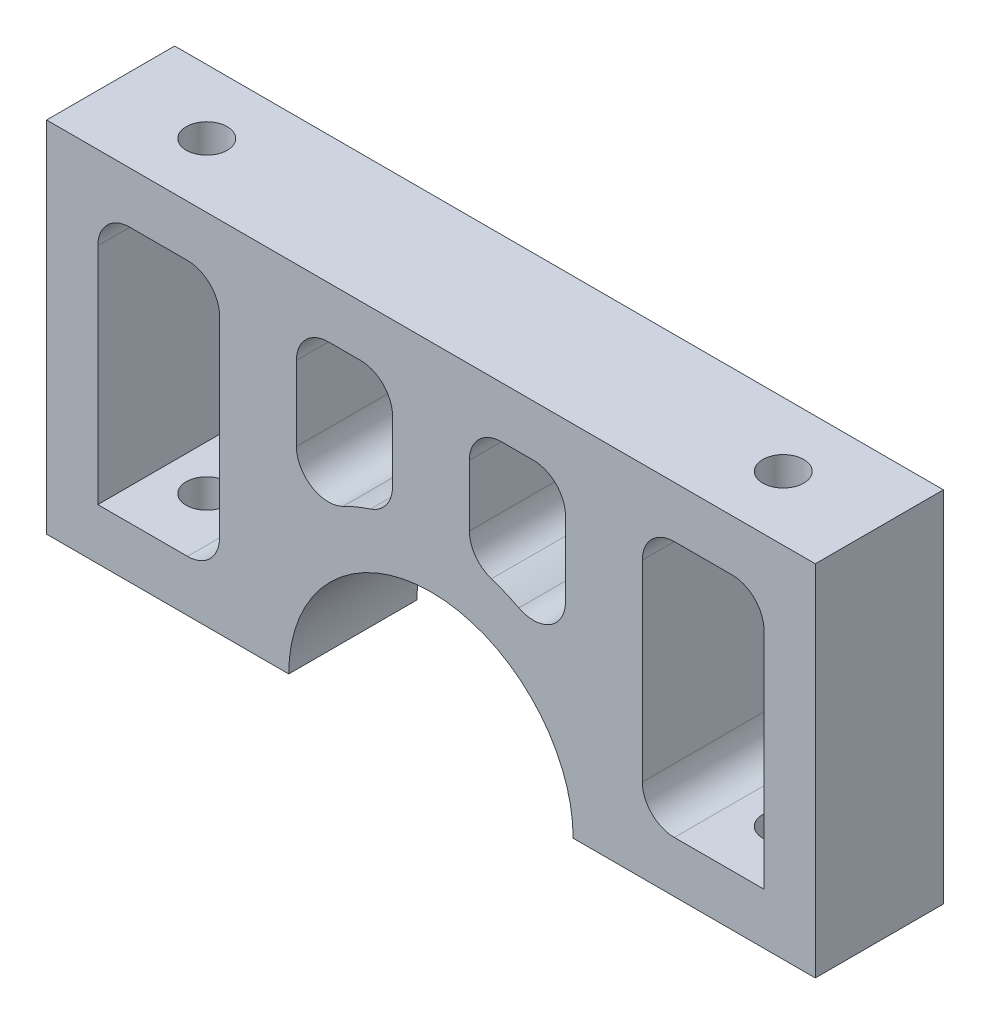
from build123d import *

# Parameters (mm, degrees)
EXTRUDE_1_DEPTH     = 10
SKETCH_2_W          = 9.5
SKETCH_2_H          = 20
CUT_EXTRUDE_2_DEPTH = 15
FILLET_1_R          = 2.5
SKETCH_3_R          = 1.6
CUT_EXTRUDE_1_DEPTH = 43.237424164


with BuildPart() as part:
    # ｽｹｯﾁ1 → ﾎﾞｽ - 押し出し1 (new body)
    with BuildSketch(Plane.XY):
        with BuildLine():
            Line((11.1, 0), (30, 0))
            Line((30, 0), (30, 28))
            Line((30, 28), (-30, 28))
            Line((-30, 28), (-30, 0))
            Line((-30, 0), (-11.1, 0))
            ThreePointArc((-11.1, 0), (0, 11.1), (11.1, 0))
        make_face()
    extrude(amount=EXTRUDE_1_DEPTH)

    # ｽｹｯﾁ2 → ｶｯﾄ - 押し出し2 (cut)
    with BuildSketch(Plane.XY.offset(10)):
        with BuildLine():
            Line((10.5, 24), (3, 24))
            Line((3, 24), (3, 14.798986452))
            ThreePointArc((3, 14.798986452), (7.032617747, 13.362345888), (10.5, 10.851727973))
            Line((10.5, 10.851727973), (10.5, 24))
        make_face()
        with BuildLine():
            Line((-3, 14.798986452), (-3, 24))
            Line((-3, 24), (-10.5, 24))
            Line((-10.5, 24), (-10.5, 10.851727973))
            ThreePointArc((-10.5, 10.851727973), (-7.032617747, 13.362345888), (-3, 14.798986452))
        make_face()
        with Locations((21.25, 14)):
            Rectangle(SKETCH_2_W, SKETCH_2_H)
        with Locations((-21.25, 14)):
            Rectangle(SKETCH_2_W, SKETCH_2_H)
    extrude(amount=-CUT_EXTRUDE_2_DEPTH, mode=Mode.SUBTRACT)

    # ﾌｨﾚｯﾄ1
    fillet_1_edges = [part.edges().sort_by_distance(p)[0] for p in [
        (-16.5, 4, 5),
        (-3, 14.798986452, 5),
        (10.5, 10.851727973, 5),
        (16.5, 4, 5),
        (3, 14.798986452, 5),
        (-10.5, 10.851727973, 5),
        (16.5, 24, 5),
        (3, 24, 5),
        (-10.5, 24, 5),
        (-26, 24, 5),
        (26, 24, 5),
        (10.5, 24, 5),
        (-3, 24, 5),
        (-16.5, 24, 5),
    ]]
    fillet(fillet_1_edges, radius=FILLET_1_R)

    # ｽｹｯﾁ3 → ｶｯﾄ - 押し出し1 (cut, through all)
    with BuildSketch(Plane(origin=(0, 28, 0), x_dir=(1, 0, 0), z_dir=(0, 1, 0))):
        with Locations((-22.5, -5)):
            Circle(SKETCH_3_R)
        with Locations((22.5, -5)):
            Circle(SKETCH_3_R)
    extrude(amount=-CUT_EXTRUDE_1_DEPTH, mode=Mode.SUBTRACT)


solid = part.part
